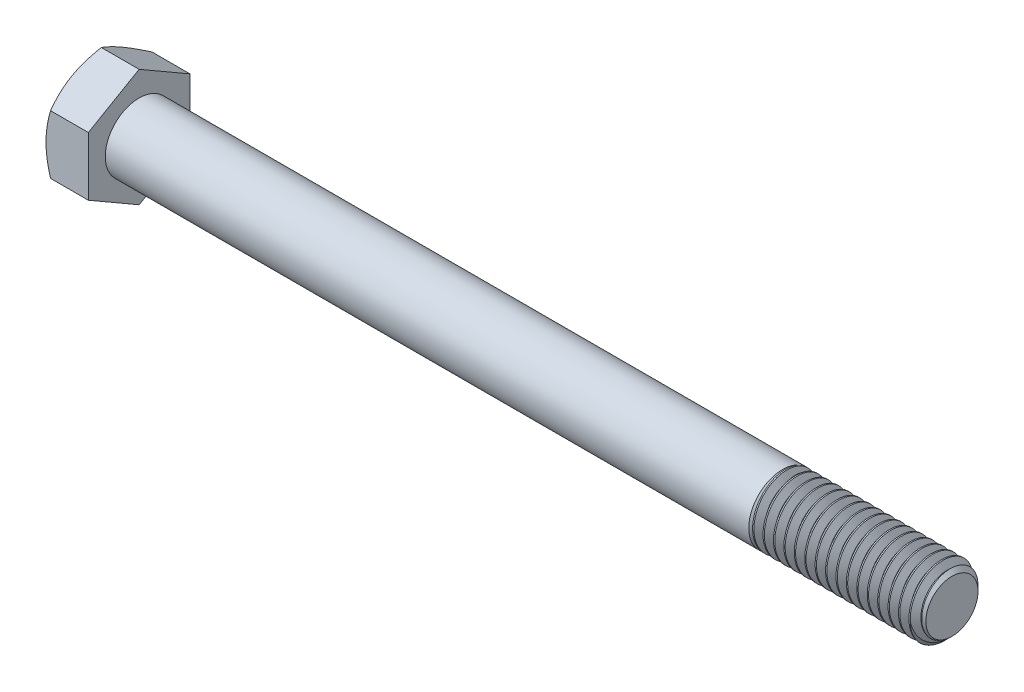
from build123d import *
from build123d.topology import SkipClean

# Parameters (mm, degrees)
SKETCH5_R           = 6.35
BOSS_EXTRUDE3_DEPTH = 152.4
CHAMFER1_SIZE       = 1.465384615
CUT_SWEEP1_PITCH    = 1.953846154
BOSS_EXTRUDE4_DEPTH = 7.9375
SKETCH8_OUTSIDE_W   = 614.812
SKETCH8_OUTSIDE_H   = 617.76
SKETCH8_OUTSIDE_R   = 9.525
CUT_EXTRUDE3_DEPTH  = 161.996295185
CUT_EXTRUDE3_DRAFT  = -60
CUT_EXTRUDE4_DEPTH  = 0.254
CIRPATTERN1_COUNT   = 3


with BuildPart() as part:
    # Sketch5 → Boss-Extrude3 (new body)
    with BuildSketch(Plane(origin=(80.16875, 0, 0), x_dir=(0, 0, -1), z_dir=(1, 0, 0))):
        Circle(SKETCH5_R)
    extrude(amount=-BOSS_EXTRUDE3_DEPTH)

    # Chamfer1
    chamfer1_edges = [part.edges().sort_by_distance(p)[0] for p in [
        (80.16875, 0, 6.35),
    ]]
    chamfer(chamfer1_edges, length=CHAMFER1_SIZE)

    # Cut-Sweep1: the profile of Sketch10 profile screwed along a right-hand helix of 17.25 turns, 10 arcs to a turn; built about Z, then put on its axis
    cut_sweep1_z = Axis((0, 0, 0), (0, 0, 1))
    cut_sweep1_corners = [(6.3503, 0, 0.000173205), (5.080939697, 0, -0.732692308), (5.080939697, 0, -0.976923077), (6.3503, 0, -1.70978859)]
    with BuildLine(mode=Mode.PRIVATE) as cut_sweep1_profile:
        Line(cut_sweep1_corners[0], cut_sweep1_corners[1])
        Line(cut_sweep1_corners[1], cut_sweep1_corners[2])
        Line(cut_sweep1_corners[2], cut_sweep1_corners[3])
        Line(cut_sweep1_corners[3], cut_sweep1_corners[0])
    cut_sweep1_cap = Face(cut_sweep1_profile.wire())
    cut_sweep1_turn_angles = [0, 18, 36, 54, 72, 90, 108, 126, 144, 162, 180, 198, 216, 234, 252, 270, 288, 306, 324, 342, 360]
    cut_sweep1_turn_weights = [1, 0.9510565162951535, 1, 0.9510565162951535, 1, 0.9510565162951535, 1, 0.9510565162951535, 1, 0.9510565162951535, 1, 0.9510565162951535, 1, 0.9510565162951535, 1, 0.9510565162951535, 1, 0.9510565162951535, 1, 0.9510565162951535, 1]
    cut_sweep1_turn_rails = [Edge.make_bspline([Vector(p[0], p[1], 0).rotate(cut_sweep1_z, cut_sweep1_turn_angles[k]) / cut_sweep1_turn_weights[k] + Vector(0, 0, p[2] + CUT_SWEEP1_PITCH * cut_sweep1_turn_angles[k] / 360) for k in range(21)], [0, 0, 0, 1, 1, 2, 2, 3, 3, 4, 4, 5, 5, 6, 6, 7, 7, 8, 8, 9, 9, 10, 10, 10], 2, cut_sweep1_turn_weights) for p in cut_sweep1_corners]
    cut_sweep1_turn_sides = [Face.make_surface_from_curves(cut_sweep1_turn_rails[p[0]], cut_sweep1_turn_rails[p[1]]) for p in [(0, 1), (1, 2), (2, 3), (3, 0)]]
    cut_sweep1_last_angles = [6120, 6138, 6156, 6174, 6192, 6201, 6210]
    cut_sweep1_last_weights = [1, 0.9510565162951535, 1, 0.9510565162951535, 1, 0.9876883405951737, 1]
    cut_sweep1_last_rails = [Edge.make_bspline([Vector(p[0], p[1], 0).rotate(cut_sweep1_z, cut_sweep1_last_angles[k]) / cut_sweep1_last_weights[k] + Vector(0, 0, p[2] + CUT_SWEEP1_PITCH * cut_sweep1_last_angles[k] / 360) for k in range(7)], [0, 0, 0, 1, 1, 2, 2, 3, 3, 3], 2, cut_sweep1_last_weights) for p in cut_sweep1_corners]
    cut_sweep1_last_sides = [Face.make_surface_from_curves(cut_sweep1_last_rails[p[0]], cut_sweep1_last_rails[p[1]]) for p in [(0, 1), (1, 2), (2, 3), (3, 0)]]
    cut_sweep1 = Plane(origin=(80.16875, 0, 0), x_dir=(0, 1, 0), z_dir=(-1, 0, 0)) * Solid(Shell([*[p.moved(Location((0, 0, CUT_SWEEP1_PITCH * i))) for i in range(17) for p in cut_sweep1_turn_sides], *cut_sweep1_last_sides, cut_sweep1_cap, cut_sweep1_cap.rotate(cut_sweep1_z, 6210).moved(Location((0, 0, CUT_SWEEP1_PITCH * 6210 / 360)))]))
    add(cut_sweep1, mode=Mode.SUBTRACT)

    # Sketch11 → Revolve1 (revolve)
    with BuildSketch(Plane.XY, mode=Mode.PRIVATE) as revolve1_sk:
        Polygon((-72.23125, 6.35), (-72.23125, 0), (54.76875, 0), (48.41875, 6.35), align=None)
    revolve(revolve1_sk.sketch.rotate(Axis((-72.23125, 0, 0), (1, 0, 0)), 270), axis=Axis((-72.23125, 0, 0), (1, 0, 0)))

    # Sketch6 → Boss-Extrude4 (add)
    with SkipClean():  # the faces are left unmerged after this step: merging them gives an invalid solid
        with BuildSketch(Plane.ZY.offset(72.23125)):
            Polygon((9.525, 5.499261314), (0, 10.998522628), (-9.525, 5.499261314), (-9.525, -5.499261314), (0, -10.998522628), (9.525, -5.499261314), align=None)
        extrude(amount=BOSS_EXTRUDE4_DEPTH)


with BuildPart() as cut_extrude3_tool:
    # Sketch8 outside → Cut-Extrude3 (with draft: the straight prism first)
    with BuildSketch(Plane.ZY.offset(80.16875)):
        Rectangle(SKETCH8_OUTSIDE_W, SKETCH8_OUTSIDE_H)
        Circle(SKETCH8_OUTSIDE_R, mode=Mode.SUBTRACT)
    extrude(amount=-CUT_EXTRUDE3_DEPTH)
    # Cut-Extrude3: the draft: its side faces are tilted about the plane it starts from
    cut_extrude3_sides = [cut_extrude3_tool.faces().sort_by_distance(p)[0] for p in [
        (0.829397593, -308.88, 0),
        (0.829397593, 0, 307.406),
        (0.829397593, 308.88, 0),
        (0.829397593, 0, -307.406),
        (0.829397593, 0, -9.525),
    ]]
    draft(cut_extrude3_sides, Plane.ZY.offset(80.16875), CUT_EXTRUDE3_DRAFT)


with BuildPart() as part_1:
    add(part.part)

    # Cut-Extrude3: cut by cut_extrude3_tool
    add(cut_extrude3_tool.part, mode=Mode.SUBTRACT)

    # Sketch12 → Cut-Extrude4 (cut)
    with SkipClean():  # the faces are left unmerged after this step: merging them gives an invalid solid
        with BuildSketch(Plane.ZY.offset(80.16875)):
            with BuildLine():
                Line((0.28575, 7.33425), (0.28575, 4.09575))
                ThreePointArc((0.28575, 4.09575), (0, 3.81), (-0.28575, 4.09575))
                Line((-0.28575, 4.09575), (-0.28575, 7.33425))
                ThreePointArc((-0.28575, 7.33425), (0, 7.62), (0.28575, 7.33425))
            make_face()
        cut_extrude4 = extrude(amount=-CUT_EXTRUDE4_DEPTH, mode=Mode.SUBTRACT)

    # CirPattern1: Cut-Extrude4 ×3 about axis
    with SkipClean():  # the faces are left unmerged after this step: merging them gives an invalid solid
        cirpattern1_axis = Axis((0, 0, 0), (1, 0, 0))
        for i in range(1, CIRPATTERN1_COUNT):
            add(cut_extrude4.rotate(cirpattern1_axis, i * 360 / CIRPATTERN1_COUNT), mode=Mode.SUBTRACT)


solid = part_1.part
